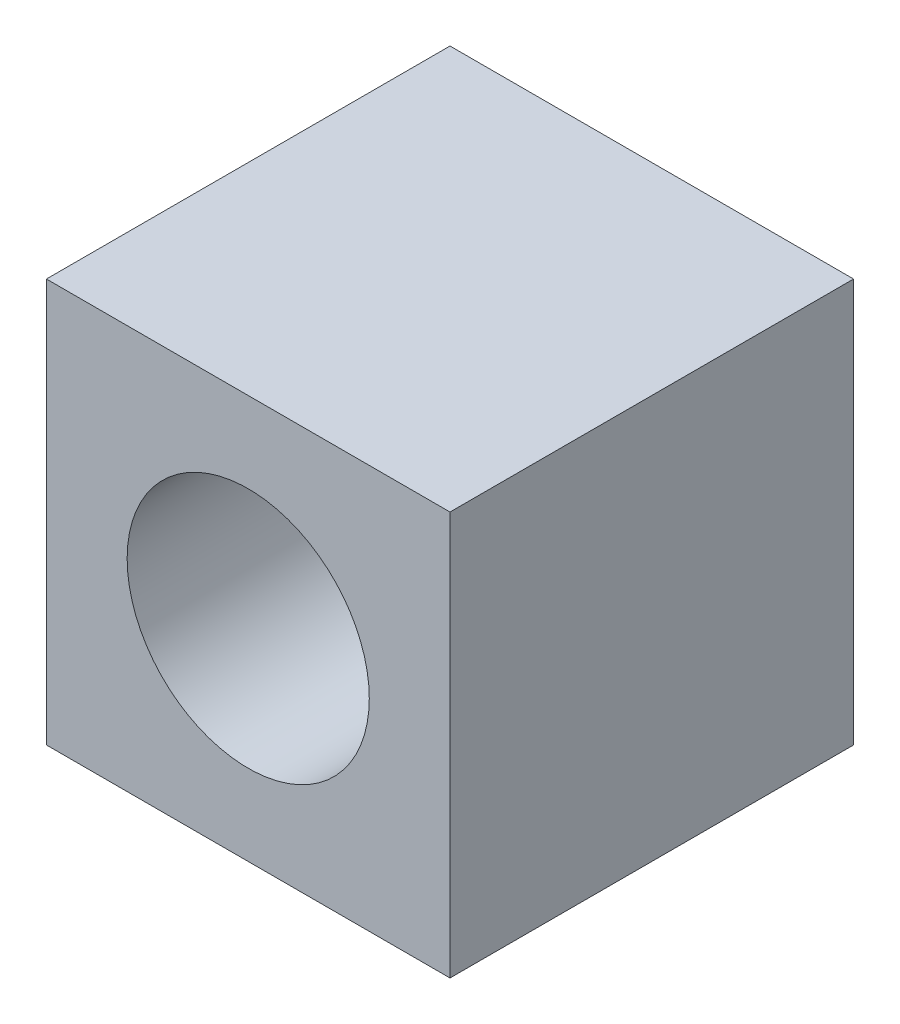
from build123d import *

# Parameters (mm, degrees)
CROQUIS1_W              = 100
CROQUIS1_H              = 100
SALIENTE_EXTRUIR1_DEPTH = 100
CROQUIS2_R              = 30
CORTAR_EXTRUIR1_DEPTH   = 123.474487139


with BuildPart() as part:
    # Croquis1 → Saliente-Extruir1 (new body)
    with BuildSketch(Plane.XY):
        Rectangle(CROQUIS1_W, CROQUIS1_H)
    extrude(amount=SALIENTE_EXTRUIR1_DEPTH)

    # Croquis2 → Cortar-Extruir1 (cut, through all)
    with BuildSketch(Plane.XY.offset(100)):
        Circle(CROQUIS2_R)
    extrude(amount=-CORTAR_EXTRUIR1_DEPTH, mode=Mode.SUBTRACT)


solid = part.part
